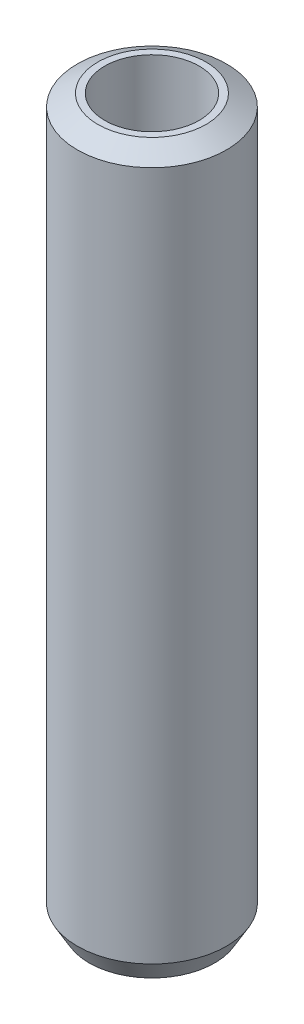
from build123d import *
from OCP.BRepFilletAPI import BRepFilletAPI_MakeChamfer

# Parameters (mm, degrees)
SKETCH1_R           = 22.5
BOSS_EXTRUDE1_DEPTH = 217.803175001
SKETCH2_R           = 14.238500228
CUT_EXTRUDE1_DEPTH  = 221.115249451
CHAMFER1_SIZE       = 3.56439921
CHAMFER1_SIZE2      = 6.173720529


with BuildPart() as part:
    # Sketch1 → Boss-Extrude1 (new body)
    with BuildSketch(Plane(origin=(0, 0, 0), x_dir=(1, 0, 0), z_dir=(0, 1, 0))):
        Circle(SKETCH1_R)
    extrude(amount=BOSS_EXTRUDE1_DEPTH)

    # Sketch2 → Cut-Extrude1 (cut, through all)
    with BuildSketch(Plane(origin=(0, 0, 0), x_dir=(1, 0, 0), z_dir=(0, 1, 0))):
        Circle(SKETCH2_R)
    extrude(amount=CUT_EXTRUDE1_DEPTH, mode=Mode.SUBTRACT)

    # Chamfer1: one chamfer whose edges measure the first distance from different faces: ONE call of the kernel's chamfer builder (chamfer() names one face for all edges)
    chamfer1_edges_1 = [part.edges().sort_by_distance(p)[0] for p in [
        (-22.5, 217.803175001, 0),
    ]]
    chamfer1_side_1 = [part.faces().sort_by_distance(p)[0] for p in [
        (-22.5, 108.901587501, 0),
    ]]
    chamfer1_edges_2 = [part.edges().sort_by_distance(p)[0] for p in [
        (-22.5, 0, 0),
    ]]
    chamfer1_side_2 = [part.faces().sort_by_distance(p)[0] for p in [
        (-21.863603897, 0, 0),
    ]]
    chamfer1 = BRepFilletAPI_MakeChamfer(part.part.solid().wrapped)
    for e in chamfer1_edges_1:
        chamfer1.Add(CHAMFER1_SIZE, CHAMFER1_SIZE2, e.wrapped, chamfer1_side_1[0].wrapped)  # the first distance lies on this face
    for e in chamfer1_edges_2:
        chamfer1.Add(CHAMFER1_SIZE, CHAMFER1_SIZE2, e.wrapped, chamfer1_side_2[0].wrapped)  # the first distance lies on this face
    add(Compound.cast(chamfer1.Shape()), mode=Mode.REPLACE)


solid = part.part
